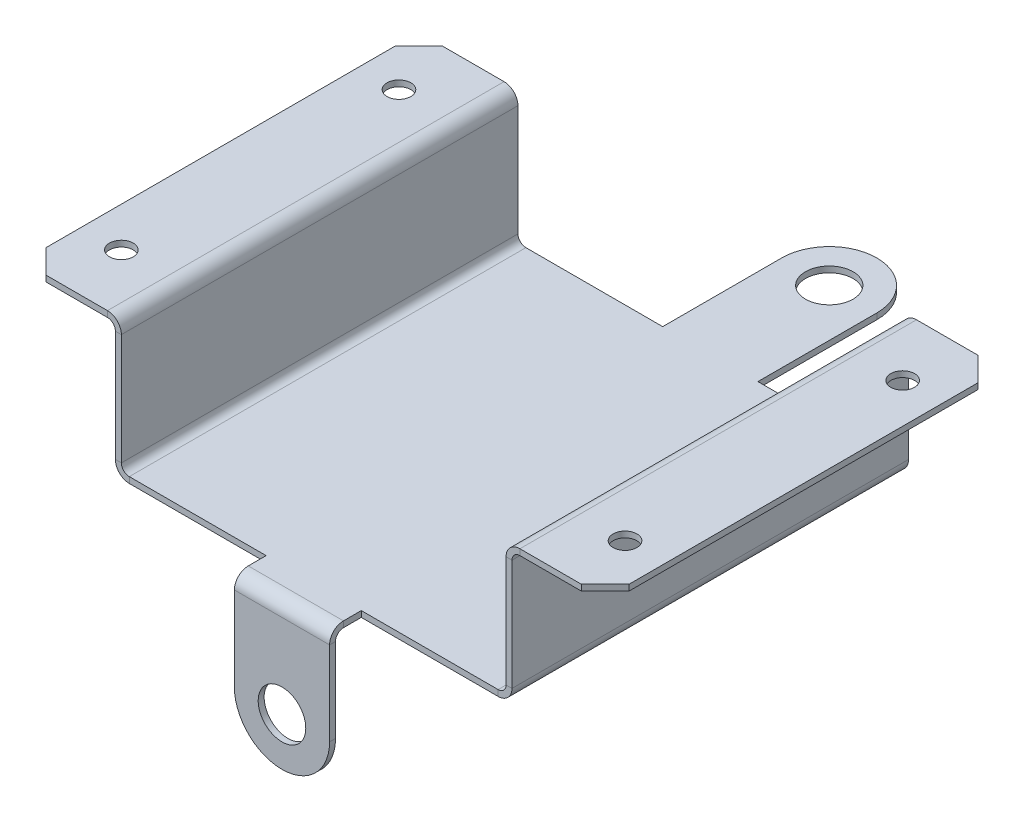
from build123d import *

# Parameters (mm, degrees)
SKETCH1_W                      = 100
SKETCH1_H                      = 100
BASE_FLANGE1_DEPTH             = 1.5
EDGE_FLANGE1_STRIP_W           = 10
EDGE_FLANGE1_STRIP_H           = 1.5
EDGE_FLANGE1_STRIP_CUT_DEPTH   = 100
EDGE_FLANGE1_STRIP_2_W         = 10
EDGE_FLANGE1_STRIP_2_H         = 1.5
EDGE_FLANGE1_STRIP_CUT_2_DEPTH = 100
EDGE_FLANGE1_DEPTH             = 100
EDGE_FLANGE1_BEND_DEPTH        = 100
EDGE_FLANGE2_STRIP_W           = 10
EDGE_FLANGE2_STRIP_H           = 1.5
EDGE_FLANGE2_STRIP_CUT_DEPTH   = 100
EDGE_FLANGE2_STRIP_2_W         = 10
EDGE_FLANGE2_STRIP_2_H         = 1.5
EDGE_FLANGE2_STRIP_CUT_2_DEPTH = 100
EDGE_FLANGE2_DEPTH             = 100
EDGE_FLANGE2_BEND_DEPTH        = 100
F_6_0_6_DIAMETER_HOLE1_D       = 6
CHAMFER1_SIZE                  = 6
SKETCH20_R                     = 6
BOSS_EXTRUDE1_DEPTH            = 1.5
SKETCHED_START                 = 57.64041
SKETCHED_BEND1_OUTLINE_W       = 24
SKETCHED_BEND1_OUTLINE_H       = 1.5
SKETCHED_BEND1_DEPTH           = 35.35959
SKETCHED_START_2               = 54.5
SKETCHED_BEND1_2_OUTLINE_R     = 6
SKETCHED_BEND1_2_DEPTH         = 3.5
SKETCHED_START_3               = -12
SKETCHED_BEND1_3_DEPTH         = 24


with BuildPart() as part:
    # Base-Flange1: sheet metal written as solids
    # Sketch1 → Base-Flange1 (new body)
    with BuildSketch(Plane(origin=(0, 0, 0), x_dir=(1, 0, 0), z_dir=(0, 1, 0))):
        Rectangle(SKETCH1_W, SKETCH1_H)
    extrude(amount=-BASE_FLANGE1_DEPTH)

    # Edge-Flange1: sheet metal written as solids
    # Edge-Flange1 strip (on a plane across the edge) → Edge-Flange1 strip cut (cut)
    with BuildSketch(Plane(origin=(-50, 0, -50), x_dir=(1, 0, 0), z_dir=(0, 0, 1))):
        with Locations((-1.5, -0.75)):
            Rectangle(EDGE_FLANGE1_STRIP_W, EDGE_FLANGE1_STRIP_H)
    extrude(amount=EDGE_FLANGE1_STRIP_CUT_DEPTH, mode=Mode.SUBTRACT)

    # Edge-Flange1 strip 2 (on a plane across the edge) → Edge-Flange1 strip cut 2 (cut)
    with BuildSketch(Plane(origin=(50, 0, 50), x_dir=(-1, 0, 0), z_dir=(0, 0, -1))):
        with Locations((-1.5, -0.75)):
            Rectangle(EDGE_FLANGE1_STRIP_2_W, EDGE_FLANGE1_STRIP_2_H)
    extrude(amount=EDGE_FLANGE1_STRIP_CUT_2_DEPTH, mode=Mode.SUBTRACT)

    # Edge-Flange1 section (on a plane across the edge) → Edge-Flange1 (add)
    with BuildSketch(Plane(origin=(-50, 0, -50), x_dir=(1, 0, 0), z_dir=(0, 0, 1))):
        with BuildLine():
            Line((0, 2), (0, 33.5))
            Line((0, 33.5), (1.5, 33.5))
            Line((1.5, 33.5), (1.5, 2))
            ThreePointArc((1.5, 2), (2.085786438, 0.585786438), (3.5, 0))
            Line((3.5, 0), (3.5, -1.5))
            ThreePointArc((3.5, -1.5), (1.025126266, -0.474873734), (0, 2))
        make_face()
    extrude(amount=EDGE_FLANGE1_DEPTH)

    # Edge-Flange1 section 2 (on a plane across the edge) → Edge-Flange1 bend (add)
    with BuildSketch(Plane(origin=(50, 0, 50), x_dir=(-1, 0, 0), z_dir=(0, 0, -1))):
        with BuildLine():
            Line((0, 2), (0, 33.5))
            Line((0, 33.5), (1.5, 33.5))
            Line((1.5, 33.5), (1.5, 2))
            ThreePointArc((1.5, 2), (2.085786438, 0.585786438), (3.5, 0))
            Line((3.5, 0), (3.5, -1.5))
            ThreePointArc((3.5, -1.5), (1.025126266, -0.474873734), (0, 2))
        make_face()
    extrude(amount=EDGE_FLANGE1_BEND_DEPTH)

    # Edge-Flange2: sheet metal written as solids
    # Edge-Flange2 strip (on a plane across the edge) → Edge-Flange2 strip cut (cut)
    with BuildSketch(Plane(origin=(-50, 33.5, 50), x_dir=(0, -1, 0), z_dir=(0, 0, -1))):
        with Locations((-1.5, -0.75)):
            Rectangle(EDGE_FLANGE2_STRIP_W, EDGE_FLANGE2_STRIP_H)
    extrude(amount=EDGE_FLANGE2_STRIP_CUT_DEPTH, mode=Mode.SUBTRACT)

    # Edge-Flange2 strip 2 (on a plane across the edge) → Edge-Flange2 strip cut 2 (cut)
    with BuildSketch(Plane(origin=(50, 33.5, -50), x_dir=(0, -1, 0), z_dir=(0, 0, 1))):
        with Locations((-1.5, -0.75)):
            Rectangle(EDGE_FLANGE2_STRIP_2_W, EDGE_FLANGE2_STRIP_2_H)
    extrude(amount=EDGE_FLANGE2_STRIP_CUT_2_DEPTH, mode=Mode.SUBTRACT)

    # Edge-Flange2 section (on a plane across the edge) → Edge-Flange2 (add)
    with BuildSketch(Plane(origin=(-50, 33.5, 50), x_dir=(0, -1, 0), z_dir=(0, 0, -1))):
        with BuildLine():
            Line((0, 2), (0, 23.5))
            Line((0, 23.5), (1.5, 23.5))
            Line((1.5, 23.5), (1.5, 2))
            ThreePointArc((1.5, 2), (2.085786438, 0.585786438), (3.5, 0))
            Line((3.5, 0), (3.5, -1.5))
            ThreePointArc((3.5, -1.5), (1.025126266, -0.474873734), (0, 2))
        make_face()
    extrude(amount=EDGE_FLANGE2_DEPTH)

    # Edge-Flange2 section 2 (on a plane across the edge) → Edge-Flange2 bend (add)
    with BuildSketch(Plane(origin=(50, 33.5, -50), x_dir=(0, -1, 0), z_dir=(0, 0, 1))):
        with BuildLine():
            Line((0, 2), (0, 23.5))
            Line((0, 23.5), (1.5, 23.5))
            Line((1.5, 23.5), (1.5, 2))
            ThreePointArc((1.5, 2), (2.085786438, 0.585786438), (3.5, 0))
            Line((3.5, 0), (3.5, -1.5))
            ThreePointArc((3.5, -1.5), (1.025126266, -0.474873734), (0, 2))
        make_face()
    extrude(amount=EDGE_FLANGE2_BEND_DEPTH)

    # Ø6.0 (6) Diameter Hole1 (through all)
    with Locations(Plane(origin=(0, 33.5, 0), x_dir=(1, 0, 0), z_dir=(0, 1, 0))):
        with Locations((-63.5, 35), (-63.5, -35), (63.5, 35), (63.5, -35)):
            Hole(F_6_0_6_DIAMETER_HOLE1_D / 2)

    # Chamfer1
    chamfer1_edges = [part.edges().sort_by_distance(p)[0] for p in [
        (-73.5, 32.75, 50),
        (-73.5, 32.75, -50),
        (73.5, 32.75, -50),
        (73.5, 32.75, 50),
    ]]
    chamfer(chamfer1_edges, length=CHAMFER1_SIZE)

    # Sketch20 → Boss-Extrude1 (add)
    # profile 1 of 2: a face of its own
    with BuildSketch(Plane(origin=(0, 0, 0), x_dir=(1, 0, 0), z_dir=(0, 1, 0))):
        with BuildLine():
            Line((-12, 50), (-12, 80))
            ThreePointArc((-12, 80), (0, 92), (12, 80))
            Line((12, 80), (12, 50))
            Line((12, 50), (-12, 50))
        make_face()
        with Locations(Location((0, 80, 0), (0, 0, 270))):
            Circle(SKETCH20_R, mode=Mode.SUBTRACT)
    # profile 2 of 2: a face of its own
    with BuildSketch(Plane(origin=(0, 0, 0), x_dir=(1, 0, 0), z_dir=(0, 1, 0))):
        with BuildLine():
            Line((12, -50), (-12, -50))
            Line((-12, -50), (-12, -80))
            ThreePointArc((-12, -80), (0, -92), (12, -80))
            Line((12, -80), (12, -50))
        make_face()
        with Locations(Location((0, -80, 0), (0, 0, 90))):
            Circle(SKETCH20_R, mode=Mode.SUBTRACT)
    extrude(amount=-BOSS_EXTRUDE1_DEPTH)

    # Sketched Bend1: read off the stored shape, not the designer's step
    # Sketched Bend1 outline → Sketched Bend1 (cut)
    with BuildSketch(Plane.XY.offset(SKETCHED_START)):
        with Locations((0, -0.75)):
            Rectangle(SKETCHED_BEND1_OUTLINE_W, SKETCHED_BEND1_OUTLINE_H)
    extrude(amount=SKETCHED_BEND1_DEPTH, mode=Mode.SUBTRACT)

    # Sketched Bend1 2 outline → Sketched Bend1 2 (add)
    with BuildSketch(Plane.XY.offset(SKETCHED_START_2)):
        with BuildLine():
            Line((-12, -1.5), (-12, -24.680310101))
            ThreePointArc((-12, -24.680310101), (0, -36.680310101), (12, -24.680310101))
            Line((12, -24.680310101), (12, -1.5))
            Line((12, -1.5), (-12, -1.5))
        make_face()
        with Locations((0, -24.680310101)):
            Circle(SKETCHED_BEND1_2_OUTLINE_R, mode=Mode.SUBTRACT)
    extrude(amount=SKETCHED_BEND1_2_DEPTH)

    # Sketched Bend1 3 outline → Sketched Bend1 3 (cut)
    with BuildSketch(Plane.YZ.offset(SKETCHED_START_3)):
        with BuildLine():
            ThreePointArc((-1.5, 54.5), (-2.085786438, 55.914213562), (-3.5, 56.5))
            Line((-3.5, 56.5), (-38, 56.5))
            Line((-38, 56.5), (-38, 54.5))
            Line((-38, 54.5), (-1.5, 54.5))
        make_face()
        with BuildLine():
            Line((-38, 59), (-38, 58.000000005))
            Line((-38, 58.000000005), (-3.5, 58))
            ThreePointArc((-3.5, 58), (-1.025126266, 56.974873734), (0, 54.5))
            Line((0, 54.5), (0, 53))
            Line((0, 53), (1, 53))
            Line((1, 53), (1, 57.64041))
            Line((1, 57.64041), (-1.5, 57.64041))
            Line((-1.5, 57.64041), (-1.5, 59))
            Line((-1.5, 59), (-38, 59))
        make_face()
    extrude(amount=SKETCHED_BEND1_3_DEPTH, mode=Mode.SUBTRACT)


solid = part.part
